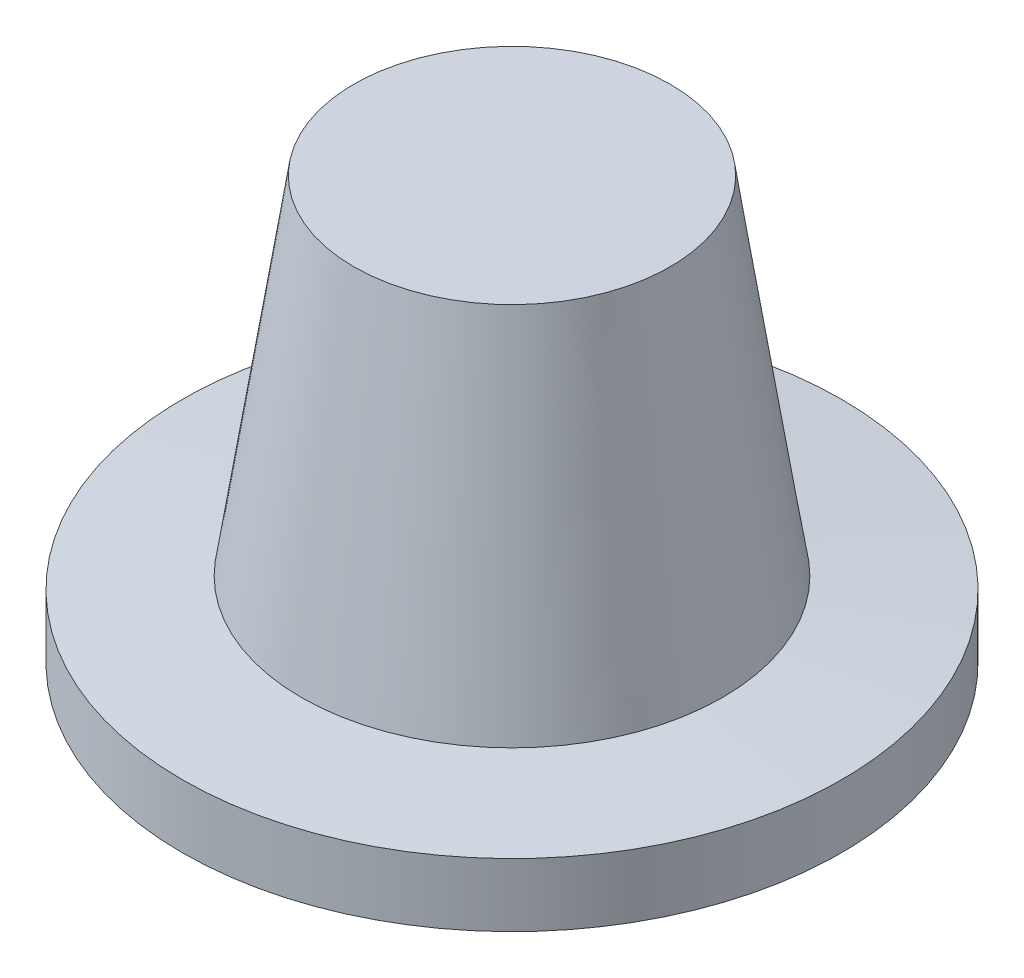
from build123d import *


with BuildPart() as part:
    # Sketch1 → Revolve1 (revolve)
    with BuildSketch(Plane.XY):
        Polygon((0, 4.572), (3.175, 4.572), (3.175, 0), (7.9375, 0), (7.9375, 1.524), (5.073101252, 1.808065191), (3.81, 10.16), (0, 10.16), align=None)
    revolve(axis=Axis((0, 0, 0), (0, 1, 0)))


solid = part.part
